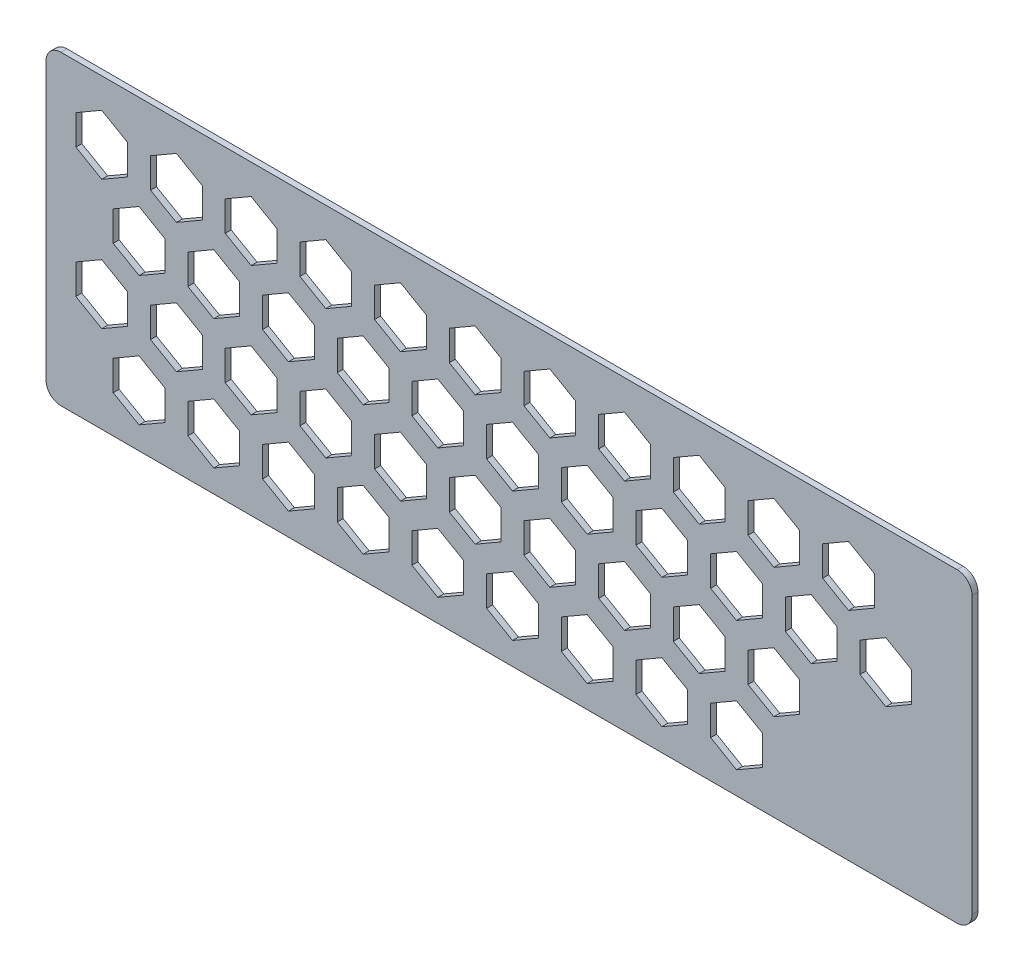
from build123d import *

# Parameters (mm, degrees)
SKETCH1_W           = 393.7
SKETCH1_H           = 130.175
BOSS_EXTRUDE1_DEPTH = 2.54
FILLET1_R           = 6.35
CUT_EXTRUDE2_DEPTH  = 208.346947786
FILL_PATTERN1_DEPTH = 2.54


# Read off the part's stored shape, not the designer's step: Fill Pattern1
with BuildPart() as part:
    # Sketch1 → Boss-Extrude1 (new body)
    with BuildSketch(Plane.XY):
        Rectangle(SKETCH1_W, SKETCH1_H)
    extrude(amount=BOSS_EXTRUDE1_DEPTH)

    # Fillet1
    fillet1_edges = [part.edges().sort_by_distance(p)[0] for p in [
        (196.85, -65.0875, 1.27),
        (-196.85, -65.0875, 1.27),
        (-196.85, 65.0875, 1.27),
        (196.85, 65.0875, 1.27),
    ]]
    fillet(fillet1_edges, radius=FILLET1_R)

    # Sketch3 → Cut-Extrude2 (cut, through all)
    with BuildSketch(Plane.XY.offset(2.54)):
        Polygon((-162.152954744, 33.3375), (-162.152954744, 46.0375), (-173.151477372, 52.3875), (-184.15, 46.0375), (-184.15, 33.3375), (-173.151477372, 26.9875), align=None)
    extrude(amount=-CUT_EXTRUDE2_DEPTH, mode=Mode.SUBTRACT)

    # Fill Pattern1 outline → Fill Pattern1 (cut)
    with BuildSketch(Plane.XY):
        Polygon((-19.277954744, -49.15141971), (-19.277954744, -36.45141971), (-30.276477372, -30.10141971), (-41.275, -36.45141971), (-41.275, -49.15141971), (-30.276477372, -55.50141971), align=None)
        Polygon((-66.902954744, -21.65511314), (-66.902954744, -8.95511314), (-77.901477372, -2.60511314), (-88.9, -8.95511314), (-88.9, -21.65511314), (-77.901477372, -28.00511314), align=None)
        Polygon((-114.527954744, 5.84119343), (-114.527954744, 18.54119343), (-125.526477372, 24.89119343), (-136.525, 18.54119343), (-136.525, 5.84119343), (-125.526477372, -0.50880657), align=None)
        Polygon((-173.151477372, -28.00511314), (-162.152954744, -21.65511314), (-162.152954744, -8.95511314), (-173.151477372, -2.60511314), (-184.15, -8.95511314), (-184.15, -21.65511314), align=None)
        Polygon((171.222045256, 5.84119343), (171.222045256, 18.54119343), (160.223522628, 24.89119343), (149.225, 18.54119343), (149.225, 5.84119343), (160.223522628, -0.50880657), align=None)
        Polygon((123.597045256, 33.3375), (123.597045256, 46.0375), (112.598522628, 52.3875), (101.6, 46.0375), (101.6, 33.3375), (112.598522628, 26.9875), align=None)
        Polygon((101.6, -21.65511314), (112.598522628, -28.00511314), (123.597045256, -21.65511314), (123.597045256, -8.95511314), (112.598522628, -2.60511314), (101.6, -8.95511314), align=None)
        Polygon((53.975, -49.15141971), (64.973522628, -55.50141971), (75.972045256, -49.15141971), (75.972045256, -36.45141971), (64.973522628, -30.10141971), (53.975, -36.45141971), align=None)
        Polygon((155.347045256, 33.3375), (155.347045256, 46.0375), (144.348522628, 52.3875), (133.35, 46.0375), (133.35, 33.3375), (144.348522628, 26.9875), align=None)
        Polygon((85.725, 5.84119343), (96.723522628, -0.50880657), (107.722045256, 5.84119343), (107.722045256, 18.54119343), (96.723522628, 24.89119343), (85.725, 18.54119343), align=None)
        Polygon((38.1, -21.65511314), (49.098522628, -28.00511314), (60.097045256, -21.65511314), (60.097045256, -8.95511314), (49.098522628, -2.60511314), (38.1, -8.95511314), align=None)
        Polygon((-9.525, -49.15141971), (1.473522628, -55.50141971), (12.472045256, -49.15141971), (12.472045256, -36.45141971), (1.473522628, -30.10141971), (-9.525, -36.45141971), align=None)
        Polygon((139.472045256, 5.84119343), (139.472045256, 18.54119343), (128.473522628, 24.89119343), (117.475, 18.54119343), (117.475, 5.84119343), (128.473522628, -0.50880657), align=None)
        Polygon((91.847045256, 33.3375), (91.847045256, 46.0375), (80.848522628, 52.3875), (69.85, 46.0375), (69.85, 33.3375), (80.848522628, 26.9875), align=None)
        Polygon((69.85, -21.65511314), (80.848522628, -28.00511314), (91.847045256, -21.65511314), (91.847045256, -8.95511314), (80.848522628, -2.60511314), (69.85, -8.95511314), align=None)
        Polygon((22.225, -49.15141971), (33.223522628, -55.50141971), (44.222045256, -49.15141971), (44.222045256, -36.45141971), (33.223522628, -30.10141971), (22.225, -36.45141971), align=None)
        Polygon((75.972045256, 5.84119343), (75.972045256, 18.54119343), (64.973522628, 24.89119343), (53.975, 18.54119343), (53.975, 5.84119343), (64.973522628, -0.50880657), align=None)
        Polygon((28.347045256, 33.3375), (28.347045256, 46.0375), (17.348522628, 52.3875), (6.35, 46.0375), (6.35, 33.3375), (17.348522628, 26.9875), align=None)
        Polygon((107.722045256, -49.15141971), (107.722045256, -36.45141971), (96.723522628, -30.10141971), (85.725, -36.45141971), (85.725, -49.15141971), (96.723522628, -55.50141971), align=None)
        Polygon((12.472045256, 5.84119343), (12.472045256, 18.54119343), (1.473522628, 24.89119343), (-9.525, 18.54119343), (-9.525, 5.84119343), (1.473522628, -0.50880657), align=None)
        Polygon((-35.152954744, 33.3375), (-35.152954744, 46.0375), (-46.151477372, 52.3875), (-57.15, 46.0375), (-57.15, 33.3375), (-46.151477372, 26.9875), align=None)
        Polygon((6.35, -21.65511314), (17.348522628, -28.00511314), (28.347045256, -21.65511314), (28.347045256, -8.95511314), (17.348522628, -2.60511314), (6.35, -8.95511314), align=None)
        Polygon((60.097045256, 33.3375), (60.097045256, 46.0375), (49.098522628, 52.3875), (38.1, 46.0375), (38.1, 33.3375), (49.098522628, 26.9875), align=None)
        Polygon((44.222045256, 5.84119343), (44.222045256, 18.54119343), (33.223522628, 24.89119343), (22.225, 18.54119343), (22.225, 5.84119343), (33.223522628, -0.50880657), align=None)
        Polygon((-3.402954744, 33.3375), (-3.402954744, 46.0375), (-14.401477372, 52.3875), (-25.4, 46.0375), (-25.4, 33.3375), (-14.401477372, 26.9875), align=None)
        Polygon((-19.277954744, 5.84119343), (-19.277954744, 18.54119343), (-30.276477372, 24.89119343), (-41.275, 18.54119343), (-41.275, 5.84119343), (-30.276477372, -0.50880657), align=None)
        Polygon((-66.902954744, 33.3375), (-66.902954744, 46.0375), (-77.901477372, 52.3875), (-88.9, 46.0375), (-88.9, 33.3375), (-77.901477372, 26.9875), align=None)
        Polygon((-25.4, -21.65511314), (-14.401477372, -28.00511314), (-3.402954744, -21.65511314), (-3.402954744, -8.95511314), (-14.401477372, -2.60511314), (-25.4, -8.95511314), align=None)
        Polygon((-73.025, -49.15141971), (-62.026477372, -55.50141971), (-51.027954744, -49.15141971), (-51.027954744, -36.45141971), (-62.026477372, -30.10141971), (-73.025, -36.45141971), align=None)
        Polygon((-51.027954744, 5.84119343), (-51.027954744, 18.54119343), (-62.026477372, 24.89119343), (-73.025, 18.54119343), (-73.025, 5.84119343), (-62.026477372, -0.50880657), align=None)
        Polygon((-98.652954744, 33.3375), (-98.652954744, 46.0375), (-109.651477372, 52.3875), (-120.65, 46.0375), (-120.65, 33.3375), (-109.651477372, 26.9875), align=None)
        Polygon((-57.15, -21.65511314), (-46.151477372, -28.00511314), (-35.152954744, -21.65511314), (-35.152954744, -8.95511314), (-46.151477372, -2.60511314), (-57.15, -8.95511314), align=None)
        Polygon((-104.775, -49.15141971), (-93.776477372, -55.50141971), (-82.777954744, -49.15141971), (-82.777954744, -36.45141971), (-93.776477372, -30.10141971), (-104.775, -36.45141971), align=None)
        Polygon((-82.777954744, 5.84119343), (-82.777954744, 18.54119343), (-93.776477372, 24.89119343), (-104.775, 18.54119343), (-104.775, 5.84119343), (-93.776477372, -0.50880657), align=None)
        Polygon((-130.402954744, 33.3375), (-130.402954744, 46.0375), (-141.401477372, 52.3875), (-152.4, 46.0375), (-152.4, 33.3375), (-141.401477372, 26.9875), align=None)
        Polygon((-136.525, -49.15141971), (-125.526477372, -55.50141971), (-114.527954744, -49.15141971), (-114.527954744, -36.45141971), (-125.526477372, -30.10141971), (-136.525, -36.45141971), align=None)
        Polygon((-120.65, -21.65511314), (-109.651477372, -28.00511314), (-98.652954744, -21.65511314), (-98.652954744, -8.95511314), (-109.651477372, -2.60511314), (-120.65, -8.95511314), align=None)
        Polygon((-168.275, -49.15141971), (-157.276477372, -55.50141971), (-146.277954744, -49.15141971), (-146.277954744, -36.45141971), (-157.276477372, -30.10141971), (-168.275, -36.45141971), align=None)
        Polygon((-146.277954744, 5.84119343), (-146.277954744, 18.54119343), (-157.276477372, 24.89119343), (-168.275, 18.54119343), (-168.275, 5.84119343), (-157.276477372, -0.50880657), align=None)
        Polygon((-152.4, -21.65511314), (-141.401477372, -28.00511314), (-130.402954744, -21.65511314), (-130.402954744, -8.95511314), (-141.401477372, -2.60511314), (-152.4, -8.95511314), align=None)
    extrude(amount=FILL_PATTERN1_DEPTH, mode=Mode.SUBTRACT)


solid = part.part
